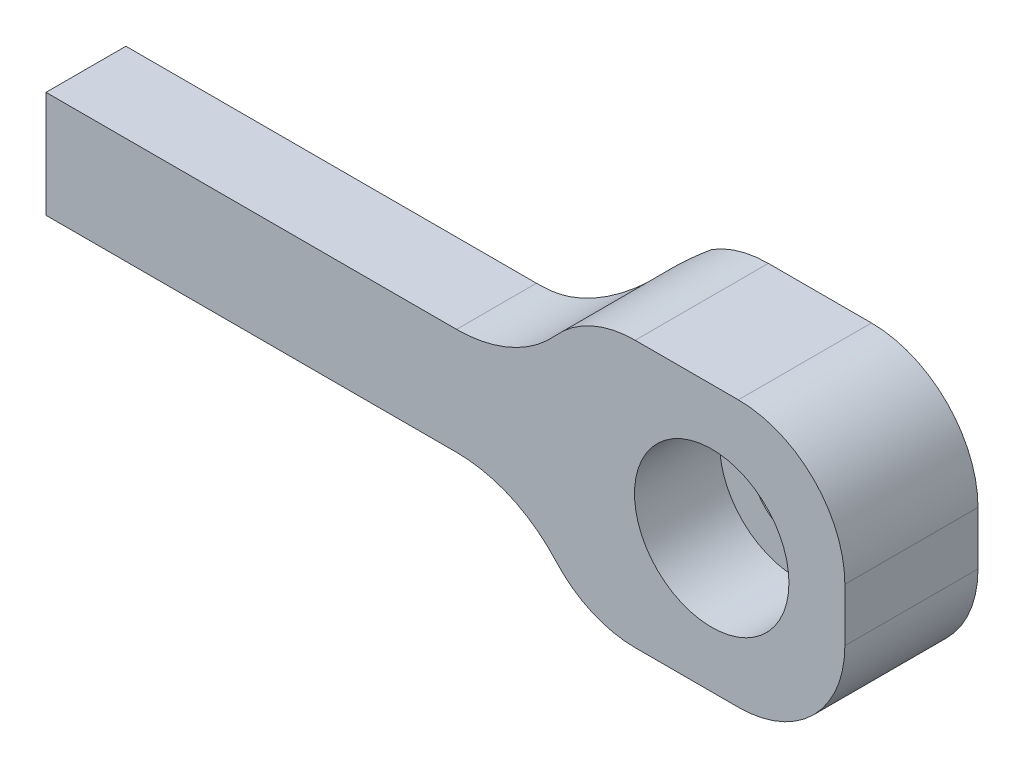
from build123d import *

# Parameters (mm, degrees)
SKETCH1_W           = 38.1
SKETCH1_H           = 12.7
BOSS_EXTRUDE1_DEPTH = 6.35
SKETCH2_R           = 2.159
CUT_EXTRUDE1_DEPTH  = 33.995567884
SKETCH3_R           = 3.683
CUT_EXTRUDE2_DEPTH  = 4.064
SKETCH5_W           = 25.4
SKETCH5_H           = 3.81
CUT_EXTRUDE3_DEPTH  = 33.995567884
SKETCH6_W           = 25.4
SKETCH6_H           = 2.54
CUT_EXTRUDE4_DEPTH  = 34.577032329
FILLET3_R           = 6.35
FILLET4_R           = 5.08


with BuildPart() as part:
    # Sketch1 → Boss-Extrude1 (new body)
    with BuildSketch(Plane.XY):
        with Locations((-12.7, 0)):
            Rectangle(SKETCH1_W, SKETCH1_H)
    extrude(amount=BOSS_EXTRUDE1_DEPTH)

    # Sketch2 → Cut-Extrude1 (cut, through all)
    with BuildSketch(Plane.XY.offset(6.35)):
        Circle(SKETCH2_R)
    extrude(amount=-CUT_EXTRUDE1_DEPTH, mode=Mode.SUBTRACT)

    # Sketch3 → Cut-Extrude2 (cut)
    with BuildSketch(Plane.XY.offset(6.35)):
        Circle(SKETCH3_R)
    extrude(amount=-CUT_EXTRUDE2_DEPTH, mode=Mode.SUBTRACT)

    # Sketch5 → Cut-Extrude3 (cut, through all)
    with BuildSketch(Plane.XY.offset(6.35)):
        with Locations((-19.05, 4.445)):
            Rectangle(SKETCH5_W, SKETCH5_H)
        with Locations((-19.05, -4.445)):
            Rectangle(SKETCH5_W, SKETCH5_H)
    extrude(amount=-CUT_EXTRUDE3_DEPTH, mode=Mode.SUBTRACT)

    # Sketch6 → Cut-Extrude4 (cut, through all)
    with BuildSketch(Plane(origin=(0, 2.54, 0), x_dir=(1, 0, 0), z_dir=(0, 1, 0))):
        with Locations((-19.05, -1.27)):
            Rectangle(SKETCH6_W, SKETCH6_H)
    extrude(amount=-CUT_EXTRUDE4_DEPTH, mode=Mode.SUBTRACT)

    # Fillet3
    # the kernel refuses this fillet: 6.35 mm, written as the material it adds along each edge
    with BuildSketch(Plane(origin=(-6.35, -2.54, 6.35), x_dir=(-1, 0, 0), z_dir=(0, 0, -1))) as fillet3_piece_1:
        with BuildLine():
            CenterArc((5.819871133, -6.35), FILLET3_R, 90, 66.421821522)
            Line((0, -3.81), (-0.116397423, -3.7592))
            ThreePointArc((-0.116397423, -3.7592), (-0.127, -1.905), (-0.127, 0))
            Line((-0.127, 0), (0, 0.127))
            Line((0, 0.127), (5.819871133, 0.127))
            Line((5.819871133, 0.127), (5.819871133, 0))
        make_face()
    extrude(amount=3.81)
    with BuildSketch(Plane(origin=(-6.35, 2.54, 2.54), x_dir=(-1, 0, 0), z_dir=(0, -1, 0))) as fillet3_piece_2:
        with BuildLine():
            CenterArc((5.08, 6.35), FILLET3_R, 216.869897646, 53.130102354)
            Line((0, 2.54), (-0.1016, 2.4638))
            ThreePointArc((-0.1016, 2.4638), (-0.127, 1.27), (-0.127, 0))
            Line((-0.127, 0), (0, -0.127))
            Line((0, -0.127), (5.08, -0.127))
            Line((5.08, -0.127), (5.08, 0))
        make_face()
    extrude(amount=5.08)
    with BuildSketch(Plane(origin=(-6.35, 2.54, 6.35), x_dir=(-1, 0, 0), z_dir=(0, 0, -1))) as fillet3_piece_3:
        with BuildLine():
            CenterArc((5.819871133, 6.35), FILLET3_R, 203.578178478, 66.421821522)
            Line((0, 3.81), (-0.116397423, 3.7592))
            ThreePointArc((-0.116397423, 3.7592), (-0.127, 1.905), (-0.127, 0))
            Line((-0.127, 0), (0, -0.127))
            Line((0, -0.127), (5.819871133, -0.127))
            Line((5.819871133, -0.127), (5.819871133, 0))
        make_face()
    extrude(amount=3.81)
    with BuildSketch(Plane(origin=(-6.35, 2.54, 2.54), x_dir=(-1, 0, 0), z_dir=(0, -1, 0))) as fillet3_piece_4a_section:
        with BuildLine():
            CenterArc((5.08, 6.35), FILLET3_R, 216.869897646, 53.130102354)
            Line((0, 2.54), (-0.1016, 2.4638))
            ThreePointArc((-0.1016, 2.4638), (-0.127, 1.27), (-0.127, 0))
            Line((-0.127, 0), (0, -0.127))
            Line((0, -0.127), (5.08, -0.127))
            Line((5.08, -0.127), (5.08, 0))
        make_face()
    fillet3_piece_4a = extrude(amount=17.78, mode=Mode.PRIVATE)
    fillet3_piece_4a = split(fillet3_piece_4a, bisect_by=Plane(origin=(-7.657359662, -6.35, 1.889832946), z_dir=(0, 1, 0)), keep=Keep.TOP, mode=Mode.PRIVATE)
    fillet3_piece_4a = split(fillet3_piece_4a, bisect_by=Plane(origin=(-7.657359662, -2.54, 1.889832946), z_dir=(0, -1, 0)), keep=Keep.TOP, mode=Mode.PRIVATE)
    with BuildSketch(Plane(origin=(-6.35, -2.54, 6.35), x_dir=(-1, 0, 0), z_dir=(0, 0, -1))) as fillet3_piece_4b_section:
        with BuildLine():
            CenterArc((5.819871133, -6.35), FILLET3_R, 90, 66.421821522)
            Line((0, -3.81), (-0.116397423, -3.7592))
            ThreePointArc((-0.116397423, -3.7592), (-0.127, -1.905), (-0.127, 0))
            Line((-0.127, 0), (0, 0.127))
            Line((0, 0.127), (5.819871133, 0.127))
            Line((5.819871133, 0.127), (5.819871133, 0))
        make_face()
    fillet3_piece_4b = extrude(amount=18.359677831, mode=Mode.PRIVATE)
    fillet3_piece_4b = split(fillet3_piece_4b, bisect_by=Plane(origin=(-7.767240906, -3.525286877, 2.54), z_dir=(0, 0, -1)), keep=Keep.TOP, mode=Mode.PRIVATE)
    fillet3_piece_4b = split(fillet3_piece_4b, bisect_by=Plane(origin=(-7.767240906, -3.525286877, 0), z_dir=(0, 0, 1)), keep=Keep.TOP, mode=Mode.PRIVATE)
    fillet3_piece_4 = fillet3_piece_4a & fillet3_piece_4b
    add(fillet3_piece_4)
    with BuildSketch(Plane(origin=(-6.35, 2.54, 6.35), x_dir=(-1, 0, 0), z_dir=(0, 0, -1))) as fillet3_piece_5a_section:
        with BuildLine():
            CenterArc((5.819871133, 6.35), FILLET3_R, 203.578178478, 66.421821522)
            Line((0, 3.81), (-0.116397423, 3.7592))
            ThreePointArc((-0.116397423, 3.7592), (-0.127, 1.905), (-0.127, 0))
            Line((-0.127, 0), (0, -0.127))
            Line((0, -0.127), (5.819871133, -0.127))
            Line((5.819871133, -0.127), (5.819871133, 0))
        make_face()
    fillet3_piece_5a = extrude(amount=18.359677831, mode=Mode.PRIVATE)
    fillet3_piece_5a = split(fillet3_piece_5a, bisect_by=Plane(origin=(-7.767240906, 3.525286877, 2.54), z_dir=(0, 0, -1)), keep=Keep.TOP, mode=Mode.PRIVATE)
    fillet3_piece_5a = split(fillet3_piece_5a, bisect_by=Plane(origin=(-7.767240906, 3.525286877, 0), z_dir=(0, 0, 1)), keep=Keep.TOP, mode=Mode.PRIVATE)
    with BuildSketch(Plane(origin=(-6.35, 15.24, 2.54), x_dir=(-1, 0, 0), z_dir=(0, -1, 0))) as fillet3_piece_5b_section:
        with BuildLine():
            CenterArc((5.08, 6.35), FILLET3_R, 216.869897646, 53.130102354)
            Line((0, 2.54), (-0.1016, 2.4638))
            ThreePointArc((-0.1016, 2.4638), (-0.127, 1.27), (-0.127, 0))
            Line((-0.127, 0), (0, -0.127))
            Line((0, -0.127), (5.08, -0.127))
            Line((5.08, -0.127), (5.08, 0))
        make_face()
    fillet3_piece_5b = extrude(amount=17.78, mode=Mode.PRIVATE)
    fillet3_piece_5b = split(fillet3_piece_5b, bisect_by=Plane(origin=(-7.657359662, 6.35, 1.889832946), z_dir=(0, -1, 0)), keep=Keep.TOP, mode=Mode.PRIVATE)
    fillet3_piece_5b = split(fillet3_piece_5b, bisect_by=Plane(origin=(-7.657359662, 2.54, 1.889832946), z_dir=(0, 1, 0)), keep=Keep.TOP, mode=Mode.PRIVATE)
    fillet3_piece_5 = fillet3_piece_5a & fillet3_piece_5b
    add(fillet3_piece_5)

    # Fillet4
    fillet4_edges = [part.edges().sort_by_distance(p)[0] for p in [
        (-6.35, 6.35, 3.175),
        (-6.35, -6.35, 3.175),
        (6.35, -6.35, 3.175),
        (6.35, 6.35, 3.175),
    ]]
    fillet(fillet4_edges, radius=FILLET4_R)


solid = part.part
